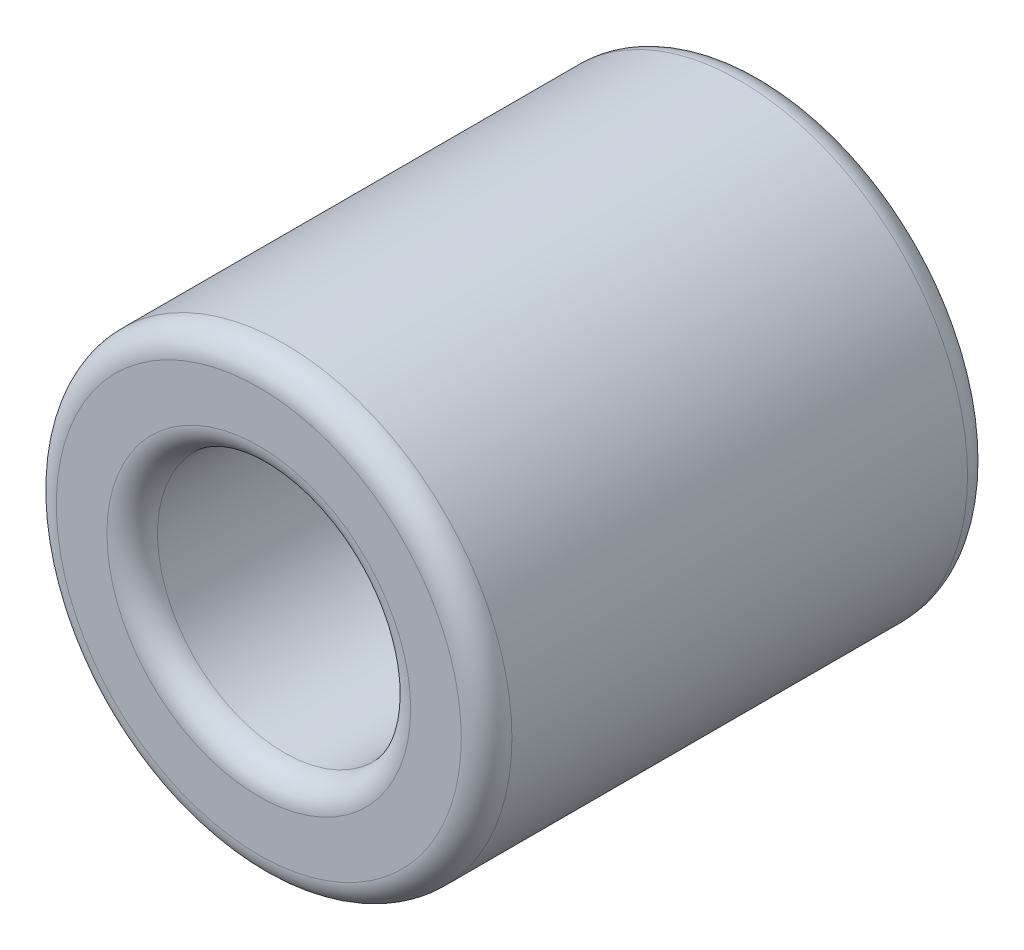
from build123d import *

# Parameters (mm, degrees)
SZKIC1_R                    = 9
SZKIC1_R_2                  = 5
DODANIE_WYCI_GNI_CIE1_DEPTH = 20
ZAOKR_GLENIE1_R             = 1


with BuildPart() as part:
    # Szkic1 → Dodanie-wyciągnięcie1 (new body)
    with BuildSketch(Plane.XY):
        Circle(SZKIC1_R)
        Circle(SZKIC1_R_2, mode=Mode.SUBTRACT)
    extrude(amount=DODANIE_WYCI_GNI_CIE1_DEPTH)

    # Zaokrąglenie1
    zaokr_glenie1_edges = [part.edges().sort_by_distance(p)[0] for p in [
        (-5, 0, 0),
        (-9, 0, 0),
        (-5, 0, 20),
        (-9, 0, 20),
    ]]
    fillet(zaokr_glenie1_edges, radius=ZAOKR_GLENIE1_R)


solid = part.part
